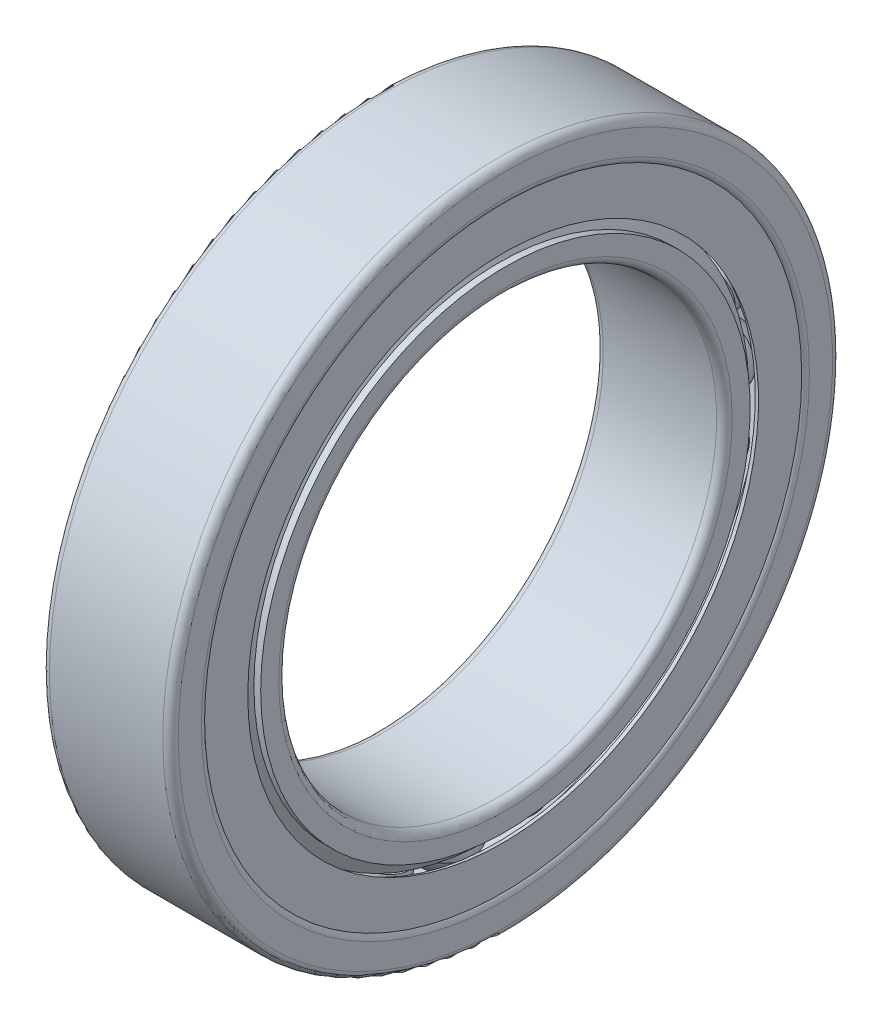
from build123d import *

# Parameters (mm, degrees)
SKETCH_5_W               = 0.6749999999999999
SKETCH_5_H               = 0.4499999999999993
PATTERN_CIRCULAR_5_COUNT = 24
PATTERN_CIRCULAR_2_COUNT = 24


with BuildPart() as part:
    # 草图2 → 旋转1 (revolve)
    with BuildSketch(Plane.XY):
        with BuildLine():
            Line((1.9499999999999984, 10.000000000000002), (2.2386751345948106, 9.500000000000002))
            Line((2.2386751345948106, 9.500000000000002), (2.4999999999999982, 9.500000000000002))
            Line((2.4999999999999982, 9.500000000000002), (2.4999999999999987, 8.800000000000006))
            ThreePointArc((2.4999999999999987, 8.800000000000006), (2.412132034355964, 8.58786796564404), (2.199999999999998, 8.500000000000004))
            Line((2.199999999999998, 8.500000000000004), (-2.2000000000000006, 8.500000000000005))
            ThreePointArc((-2.2000000000000006, 8.500000000000005), (-2.412132034355965, 8.587867965644042), (-2.5000000000000004, 8.800000000000006))
            Line((-2.5000000000000004, 8.800000000000006), (-2.4999999999999973, 9.500000000000002))
            Line((-2.4999999999999973, 9.500000000000002), (-2.2386751345948097, 9.500000000000002))
            Line((-2.2386751345948097, 9.500000000000002), (-1.949999999999998, 10.000000000000002))
            Line((-1.949999999999998, 10.000000000000002), (-0.8385254915624256, 10.000000000000004))
            ThreePointArc((-0.8385254915624256, 10.000000000000004), (5.6e-16, 9.624999999999998), (0.8385254915624261, 10.000000000000004))
            Line((0.8385254915624261, 10.000000000000004), (1.9499999999999984, 10.000000000000002))
        make_face()
        with BuildLine():
            Line((-2.5000000000000013, 12.7), (-2.5000000000000013, 11.799999999999999))
            ThreePointArc((-2.5000000000000013, 11.799999999999999), (-2.412132034355966, 11.587867965644035), (-2.2000000000000015, 11.5))
            Line((-2.2000000000000015, 11.5), (-0.838525491562418, 11.500000000000004))
            ThreePointArc((-0.838525491562418, 11.500000000000004), (3.1e-16, 11.875), (0.8385254915624182, 11.500000000000004))
            Line((0.8385254915624182, 11.500000000000004), (2.2000000000000073, 11.500000000000004))
            ThreePointArc((2.2000000000000073, 11.500000000000004), (2.412132034355975, 11.58786796564404), (2.500000000000016, 11.800000000000006))
            Line((2.500000000000016, 11.800000000000006), (2.499999999999998, 12.700000000000001))
            ThreePointArc((2.499999999999998, 12.700000000000001), (2.4121320343559622, 12.912132034355965), (2.199999999999998, 13.000000000000002))
            Line((2.199999999999998, 13.000000000000002), (-2.2000000000000006, 13.000000000000002))
            ThreePointArc((-2.2000000000000006, 13.000000000000002), (-2.4121320343559667, 12.912132034355965), (-2.5000000000000013, 12.7))
        make_face()
    revolve(axis=Axis((-3.4999999999999996, 0, 0), (1, 0, 0)))


with BuildPart() as body_2:
    # 草图5 → 旋转3 (revolve)
    with BuildSketch(Plane.XY):
        with Locations((1.61e-15, 10.749999999999998)):
            Rectangle(SKETCH_5_W, SKETCH_5_H)
    revolve(axis=Axis((-19.927092192426834, 0, 0), (1, 0, 0)))



with BuildPart() as body_3:
    # 草图3 → 旋转2 (revolve)
    with BuildSketch(Plane.XY):
        with BuildLine():
            ThreePointArc((1.2374999999999987, 10.75), (-5e-17, 11.987499999999997), (-1.2374999999999987, 10.75))
            Line((-1.2374999999999985, 10.75), (1.2374999999999985, 10.75))
        make_face()
    revolve(axis=Axis((-1.2374999999999985, 10.75, 0), (1, 0, 0)))


with BuildPart() as pattern_circular_5_1:
    # 阵列(圆周)5: pattern copy
    add(body_3.part.rotate(Axis((-3.8500000000000054, 0, 0), (1, 0, 0)), 1 * 360 / PATTERN_CIRCULAR_5_COUNT))


with BuildPart() as pattern_circular_5_2:
    # 阵列(圆周)5: pattern copy
    add(body_3.part.rotate(Axis((-3.8500000000000054, 0, 0), (1, 0, 0)), 2 * 360 / PATTERN_CIRCULAR_5_COUNT))


with BuildPart() as pattern_circular_5_3:
    # 阵列(圆周)5: pattern copy
    add(body_3.part.rotate(Axis((-3.8500000000000054, 0, 0), (1, 0, 0)), 3 * 360 / PATTERN_CIRCULAR_5_COUNT))


with BuildPart() as pattern_circular_5_4:
    # 阵列(圆周)5: pattern copy
    add(body_3.part.rotate(Axis((-3.8500000000000054, 0, 0), (1, 0, 0)), 4 * 360 / PATTERN_CIRCULAR_5_COUNT))


with BuildPart() as pattern_circular_5_5:
    # 阵列(圆周)5: pattern copy
    add(body_3.part.rotate(Axis((-3.8500000000000054, 0, 0), (1, 0, 0)), 5 * 360 / PATTERN_CIRCULAR_5_COUNT))


with BuildPart() as pattern_circular_5_6:
    # 阵列(圆周)5: pattern copy
    add(body_3.part.rotate(Axis((-3.8500000000000054, 0, 0), (1, 0, 0)), 6 * 360 / PATTERN_CIRCULAR_5_COUNT))


with BuildPart() as pattern_circular_5_7:
    # 阵列(圆周)5: pattern copy
    add(body_3.part.rotate(Axis((-3.8500000000000054, 0, 0), (1, 0, 0)), 7 * 360 / PATTERN_CIRCULAR_5_COUNT))


with BuildPart() as pattern_circular_5_8:
    # 阵列(圆周)5: pattern copy
    add(body_3.part.rotate(Axis((-3.8500000000000054, 0, 0), (1, 0, 0)), 8 * 360 / PATTERN_CIRCULAR_5_COUNT))


with BuildPart() as pattern_circular_5_9:
    # 阵列(圆周)5: pattern copy
    add(body_3.part.rotate(Axis((-3.8500000000000054, 0, 0), (1, 0, 0)), 9 * 360 / PATTERN_CIRCULAR_5_COUNT))


with BuildPart() as pattern_circular_5_10:
    # 阵列(圆周)5: pattern copy
    add(body_3.part.rotate(Axis((-3.8500000000000054, 0, 0), (1, 0, 0)), 10 * 360 / PATTERN_CIRCULAR_5_COUNT))


with BuildPart() as pattern_circular_5_11:
    # 阵列(圆周)5: pattern copy
    add(body_3.part.rotate(Axis((-3.8500000000000054, 0, 0), (1, 0, 0)), 11 * 360 / PATTERN_CIRCULAR_5_COUNT))


with BuildPart() as pattern_circular_5_12:
    # 阵列(圆周)5: pattern copy
    add(body_3.part.rotate(Axis((-3.8500000000000054, 0, 0), (1, 0, 0)), 12 * 360 / PATTERN_CIRCULAR_5_COUNT))


with BuildPart() as pattern_circular_5_13:
    # 阵列(圆周)5: pattern copy
    add(body_3.part.rotate(Axis((-3.8500000000000054, 0, 0), (1, 0, 0)), 13 * 360 / PATTERN_CIRCULAR_5_COUNT))


with BuildPart() as pattern_circular_5_14:
    # 阵列(圆周)5: pattern copy
    add(body_3.part.rotate(Axis((-3.8500000000000054, 0, 0), (1, 0, 0)), 14 * 360 / PATTERN_CIRCULAR_5_COUNT))


with BuildPart() as pattern_circular_5_15:
    # 阵列(圆周)5: pattern copy
    add(body_3.part.rotate(Axis((-3.8500000000000054, 0, 0), (1, 0, 0)), 15 * 360 / PATTERN_CIRCULAR_5_COUNT))


with BuildPart() as pattern_circular_5_16:
    # 阵列(圆周)5: pattern copy
    add(body_3.part.rotate(Axis((-3.8500000000000054, 0, 0), (1, 0, 0)), 16 * 360 / PATTERN_CIRCULAR_5_COUNT))


with BuildPart() as pattern_circular_5_17:
    # 阵列(圆周)5: pattern copy
    add(body_3.part.rotate(Axis((-3.8500000000000054, 0, 0), (1, 0, 0)), 17 * 360 / PATTERN_CIRCULAR_5_COUNT))


with BuildPart() as pattern_circular_5_18:
    # 阵列(圆周)5: pattern copy
    add(body_3.part.rotate(Axis((-3.8500000000000054, 0, 0), (1, 0, 0)), 18 * 360 / PATTERN_CIRCULAR_5_COUNT))


with BuildPart() as pattern_circular_5_19:
    # 阵列(圆周)5: pattern copy
    add(body_3.part.rotate(Axis((-3.8500000000000054, 0, 0), (1, 0, 0)), 19 * 360 / PATTERN_CIRCULAR_5_COUNT))


with BuildPart() as pattern_circular_5_20:
    # 阵列(圆周)5: pattern copy
    add(body_3.part.rotate(Axis((-3.8500000000000054, 0, 0), (1, 0, 0)), 20 * 360 / PATTERN_CIRCULAR_5_COUNT))


with BuildPart() as pattern_circular_5_21:
    # 阵列(圆周)5: pattern copy
    add(body_3.part.rotate(Axis((-3.8500000000000054, 0, 0), (1, 0, 0)), 21 * 360 / PATTERN_CIRCULAR_5_COUNT))


with BuildPart() as pattern_circular_5_22:
    # 阵列(圆周)5: pattern copy
    add(body_3.part.rotate(Axis((-3.8500000000000054, 0, 0), (1, 0, 0)), 22 * 360 / PATTERN_CIRCULAR_5_COUNT))


with BuildPart() as pattern_circular_5_23:
    # 阵列(圆周)5: pattern copy
    add(body_3.part.rotate(Axis((-3.8500000000000054, 0, 0), (1, 0, 0)), 23 * 360 / PATTERN_CIRCULAR_5_COUNT))


with BuildPart() as cut_revolve_1_tool:
    # 草图6 → 切除-旋转1 (revolve)
    with BuildSketch(Plane.XY):
        with BuildLine():
            Line((-1.2168735554690955, 10.974999999999998), (1.2168735554690955, 10.974999999999998))
            ThreePointArc((1.2168735554690955, 10.974999999999998), (1.04e-15, 11.987499999999997), (-1.2168735554690955, 10.974999999999998))
        make_face()
        with BuildLine():
            Line((-1.2168735554690955, 10.525), (1.2168735554690955, 10.525))
            ThreePointArc((1.2168735554690955, 10.525), (1.04e-15, 9.5125), (-1.2168735554690955, 10.525))
        make_face()
    revolve(axis=Axis((-19.927092192426834, 0, 0), (1, 0, 0)))


with BuildPart() as part_1:
    add(part.part)

    # 切除-旋转1: cut by cut_revolve_1_tool
    add(cut_revolve_1_tool.part, mode=Mode.SUBTRACT)

    # 草图9 → 旋转5 (revolve)
    with BuildSketch(Plane.XY):
        with BuildLine():
            Line((2.2000000000000073, 11.500000000000004), (2.2000000000000037, 9.999999999999998))
            ThreePointArc((2.2000000000000037, 9.999999999999998), (2.314805029709532, 9.977163859753395), (2.4121320343559716, 9.912132034355974))
            Line((2.4121320343559716, 9.912132034355974), (2.4121320343559756, 11.587867965644039))
            ThreePointArc((2.4121320343559756, 11.587867965644039), (2.314805029709536, 11.522836140246618), (2.2000000000000073, 11.500000000000004))
        make_face()
        with BuildLine():
            Line((-2.4121320343559747, 11.587867965644039), (-2.4121320343559707, 9.912132034355974))
            ThreePointArc((-2.4121320343559707, 9.912132034355974), (-2.314805029709531, 9.977163859753395), (-2.200000000000003, 9.999999999999998))
            Line((-2.200000000000003, 9.999999999999998), (-2.200000000000007, 11.500000000000004))
            ThreePointArc((-2.200000000000007, 11.500000000000004), (-2.314805029709535, 11.522836140246618), (-2.4121320343559747, 11.587867965644039))
        make_face()
    revolve(axis=Axis((-19.927092192426834, 0, 0), (1, 0, 0)))


with BuildPart() as body_3_1:
    add(body_3.part)

    # 切除-旋转1: cut by cut_revolve_1_tool
    add(cut_revolve_1_tool.part, mode=Mode.SUBTRACT)


with BuildPart() as pattern_circular_5_1_1:
    add(pattern_circular_5_1.part)

    # 切除-旋转1: cut by cut_revolve_1_tool
    add(cut_revolve_1_tool.part, mode=Mode.SUBTRACT)


with BuildPart() as pattern_circular_5_2_1:
    add(pattern_circular_5_2.part)

    # 切除-旋转1: cut by cut_revolve_1_tool
    add(cut_revolve_1_tool.part, mode=Mode.SUBTRACT)


with BuildPart() as pattern_circular_5_3_1:
    add(pattern_circular_5_3.part)

    # 切除-旋转1: cut by cut_revolve_1_tool
    add(cut_revolve_1_tool.part, mode=Mode.SUBTRACT)


with BuildPart() as pattern_circular_5_4_1:
    add(pattern_circular_5_4.part)

    # 切除-旋转1: cut by cut_revolve_1_tool
    add(cut_revolve_1_tool.part, mode=Mode.SUBTRACT)


with BuildPart() as pattern_circular_5_5_1:
    add(pattern_circular_5_5.part)

    # 切除-旋转1: cut by cut_revolve_1_tool
    add(cut_revolve_1_tool.part, mode=Mode.SUBTRACT)


with BuildPart() as pattern_circular_5_6_1:
    add(pattern_circular_5_6.part)

    # 切除-旋转1: cut by cut_revolve_1_tool
    add(cut_revolve_1_tool.part, mode=Mode.SUBTRACT)


with BuildPart() as pattern_circular_5_7_1:
    add(pattern_circular_5_7.part)

    # 切除-旋转1: cut by cut_revolve_1_tool
    add(cut_revolve_1_tool.part, mode=Mode.SUBTRACT)


with BuildPart() as pattern_circular_5_8_1:
    add(pattern_circular_5_8.part)

    # 切除-旋转1: cut by cut_revolve_1_tool
    add(cut_revolve_1_tool.part, mode=Mode.SUBTRACT)


with BuildPart() as pattern_circular_5_9_1:
    add(pattern_circular_5_9.part)

    # 切除-旋转1: cut by cut_revolve_1_tool
    add(cut_revolve_1_tool.part, mode=Mode.SUBTRACT)


with BuildPart() as pattern_circular_5_10_1:
    add(pattern_circular_5_10.part)

    # 切除-旋转1: cut by cut_revolve_1_tool
    add(cut_revolve_1_tool.part, mode=Mode.SUBTRACT)


with BuildPart() as pattern_circular_5_11_1:
    add(pattern_circular_5_11.part)

    # 切除-旋转1: cut by cut_revolve_1_tool
    add(cut_revolve_1_tool.part, mode=Mode.SUBTRACT)


with BuildPart() as pattern_circular_5_12_1:
    add(pattern_circular_5_12.part)

    # 切除-旋转1: cut by cut_revolve_1_tool
    add(cut_revolve_1_tool.part, mode=Mode.SUBTRACT)


with BuildPart() as pattern_circular_5_13_1:
    add(pattern_circular_5_13.part)

    # 切除-旋转1: cut by cut_revolve_1_tool
    add(cut_revolve_1_tool.part, mode=Mode.SUBTRACT)


with BuildPart() as pattern_circular_5_14_1:
    add(pattern_circular_5_14.part)

    # 切除-旋转1: cut by cut_revolve_1_tool
    add(cut_revolve_1_tool.part, mode=Mode.SUBTRACT)


with BuildPart() as pattern_circular_5_15_1:
    add(pattern_circular_5_15.part)

    # 切除-旋转1: cut by cut_revolve_1_tool
    add(cut_revolve_1_tool.part, mode=Mode.SUBTRACT)


with BuildPart() as pattern_circular_5_16_1:
    add(pattern_circular_5_16.part)

    # 切除-旋转1: cut by cut_revolve_1_tool
    add(cut_revolve_1_tool.part, mode=Mode.SUBTRACT)


with BuildPart() as pattern_circular_5_17_1:
    add(pattern_circular_5_17.part)

    # 切除-旋转1: cut by cut_revolve_1_tool
    add(cut_revolve_1_tool.part, mode=Mode.SUBTRACT)


with BuildPart() as pattern_circular_5_18_1:
    add(pattern_circular_5_18.part)

    # 切除-旋转1: cut by cut_revolve_1_tool
    add(cut_revolve_1_tool.part, mode=Mode.SUBTRACT)


with BuildPart() as pattern_circular_5_19_1:
    add(pattern_circular_5_19.part)

    # 切除-旋转1: cut by cut_revolve_1_tool
    add(cut_revolve_1_tool.part, mode=Mode.SUBTRACT)


with BuildPart() as pattern_circular_5_20_1:
    add(pattern_circular_5_20.part)

    # 切除-旋转1: cut by cut_revolve_1_tool
    add(cut_revolve_1_tool.part, mode=Mode.SUBTRACT)


with BuildPart() as pattern_circular_5_21_1:
    add(pattern_circular_5_21.part)

    # 切除-旋转1: cut by cut_revolve_1_tool
    add(cut_revolve_1_tool.part, mode=Mode.SUBTRACT)


with BuildPart() as pattern_circular_5_22_1:
    add(pattern_circular_5_22.part)

    # 切除-旋转1: cut by cut_revolve_1_tool
    add(cut_revolve_1_tool.part, mode=Mode.SUBTRACT)


with BuildPart() as pattern_circular_5_23_1:
    add(pattern_circular_5_23.part)

    # 切除-旋转1: cut by cut_revolve_1_tool
    add(cut_revolve_1_tool.part, mode=Mode.SUBTRACT)


with BuildPart() as body_2_1:
    add(body_2.part)

    add(body_3_1.part)  # 旋转4 merges body 3
    # 草图7 → 旋转4 (revolve)
    with BuildSketch(Plane.XY):
        with BuildLine():
            Line((-1.1250000000000002, 10.75), (1.1250000000000002, 10.75))
            ThreePointArc((1.1250000000000002, 10.75), (1.31e-15, 11.874999999999998), (-1.1250000000000002, 10.75))
        make_face()
    revolve_4 = revolve(axis=Axis((-1.1250000000000002, 10.75, 0), (1, 0, 0)))

    # 阵列(圆周)2: 旋转4 ×24 about axis
    pattern_circular_2_axis = Axis((-3.8500000000000054, 0, 0), (1, 0, 0))
    for i in range(1, PATTERN_CIRCULAR_2_COUNT):
        add(revolve_4.rotate(pattern_circular_2_axis, i * 360 / PATTERN_CIRCULAR_2_COUNT))


solid = Compound([part_1.part, pattern_circular_5_1_1.part, pattern_circular_5_2_1.part, pattern_circular_5_3_1.part, pattern_circular_5_4_1.part, pattern_circular_5_5_1.part, pattern_circular_5_6_1.part, pattern_circular_5_7_1.part, pattern_circular_5_8_1.part, pattern_circular_5_9_1.part, pattern_circular_5_10_1.part, pattern_circular_5_11_1.part, pattern_circular_5_12_1.part, pattern_circular_5_13_1.part, pattern_circular_5_14_1.part, pattern_circular_5_15_1.part, pattern_circular_5_16_1.part, pattern_circular_5_17_1.part, pattern_circular_5_18_1.part, pattern_circular_5_19_1.part, pattern_circular_5_20_1.part, pattern_circular_5_21_1.part, pattern_circular_5_22_1.part, pattern_circular_5_23_1.part, body_2_1.part])
